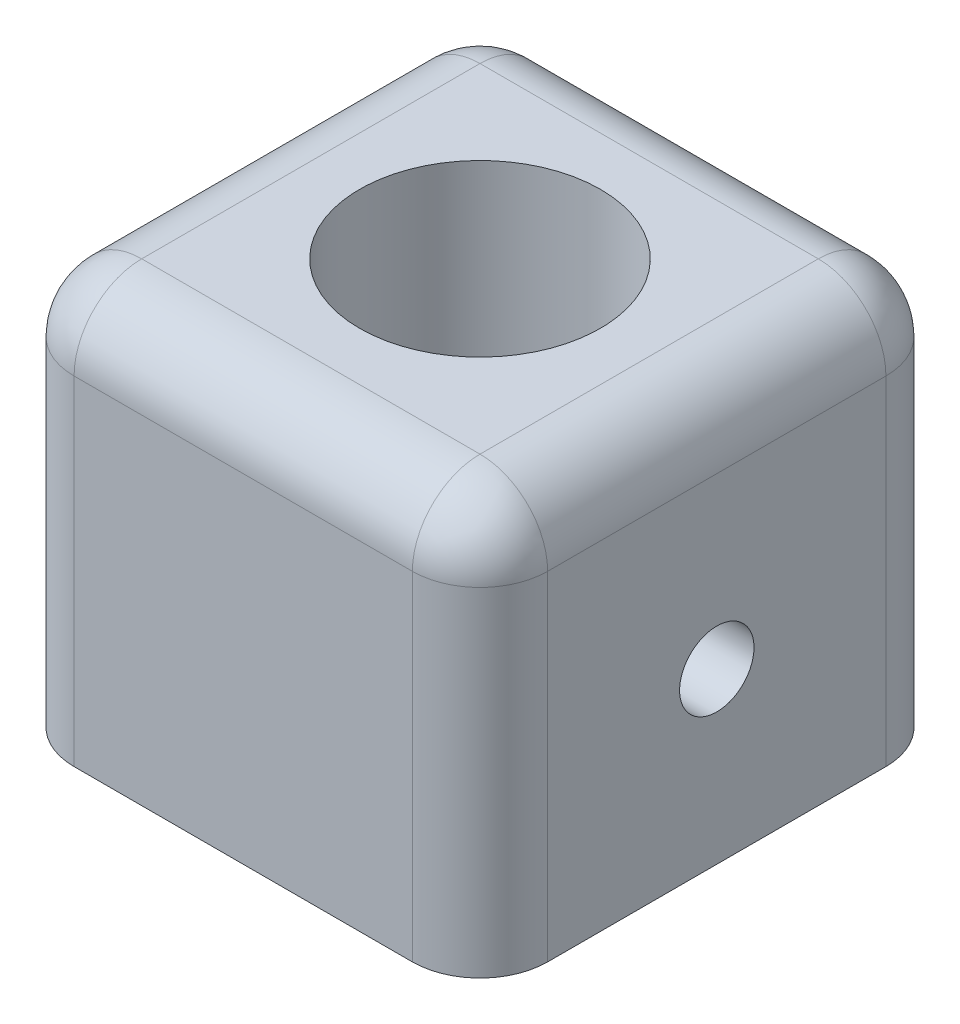
from build123d import *

# Parameters (mm, degrees)
SKETCH1_W                      = 35
SKETCH1_H                      = 35
BOSS_EXTRUDE1_DEPTH            = 30
SKETCH2_W                      = 20
SKETCH2_H                      = 20
CUT_EXTRUDE1_DEPTH             = 15
SKETCH3_R                      = 8.9
CUT_EXTRUDE2_DEPTH             = 58.879184514
CBORE_FOR_M2_SHCS1_D           = 2.6
CBORE_FOR_M2_SHCS1_DEPTH       = 7.5
CBORE_FOR_M2_SHCS1_CBORE_D     = 5.5
CBORE_FOR_M2_SHCS1_CBORE_DEPTH = 6
CBORE_FOR_M2_SHCS2_D           = 2.6
CBORE_FOR_M2_SHCS2_CBORE_D     = 5.5
CBORE_FOR_M2_SHCS2_CBORE_DEPTH = 6
FILLET1_R                      = 5
FILLET2_R                      = 5
M3X0_5_TAPPED_HOLE1_D          = 2.5
M3X0_5_TAPPED_HOLE1_DEPTH      = 5
M3X0_5_TAPPED_HOLE1_TIP        = 0.751075774


with BuildPart() as part:
    # Sketch1 → Boss-Extrude1 (new body)
    with BuildSketch(Plane(origin=(0, 0, 0), x_dir=(1, 0, 0), z_dir=(0, 1, 0))):
        with Locations((17.5, 17.5)):
            Rectangle(SKETCH1_W, SKETCH1_H)
    extrude(amount=BOSS_EXTRUDE1_DEPTH)

    # Sketch2 → Cut-Extrude1 (cut)
    with BuildSketch(Plane.XZ):
        with Locations((17.5, -17.5)):
            Rectangle(SKETCH2_W, SKETCH2_H)
    extrude(amount=-CUT_EXTRUDE1_DEPTH, mode=Mode.SUBTRACT)

    # Sketch3 → Cut-Extrude2 (cut, through all)
    with BuildSketch(Plane(origin=(0, 30, 0), x_dir=(1, 0, 0), z_dir=(0, 1, 0))):
        with Locations(Location((17.5, 17.5, 0), (0, 0, 270))):
            Circle(SKETCH3_R)
    extrude(amount=-CUT_EXTRUDE2_DEPTH, mode=Mode.SUBTRACT)

    # CBORE for M2 SHCS1
    with Locations(Plane(origin=(35, 12.5, -17.5), x_dir=(0, 0, 1), z_dir=(1, 0, 0))):
        with Locations((0, 0)):
            CounterBoreHole(CBORE_FOR_M2_SHCS1_D / 2, CBORE_FOR_M2_SHCS1_CBORE_D / 2, CBORE_FOR_M2_SHCS1_CBORE_DEPTH, depth=CBORE_FOR_M2_SHCS1_DEPTH)

    # CBORE for M2 SHCS2 (through all)
    with Locations(Plane(origin=(0, 12.5, -17.5), x_dir=(0, 0, -1), z_dir=(-1, 0, 0))):
        with Locations((0, 0)):
            CounterBoreHole(CBORE_FOR_M2_SHCS2_D / 2, CBORE_FOR_M2_SHCS2_CBORE_D / 2, CBORE_FOR_M2_SHCS2_CBORE_DEPTH)

    # Fillet1
    fillet1_edges = [part.edges().sort_by_distance(p)[0] for p in [
        (35, 30, -17.5),
        (17.5, 30, -35),
        (0, 30, -17.5),
        (17.5, 30, 0),
    ]]
    fillet(fillet1_edges, radius=FILLET1_R)

    # Fillet2
    # the kernel refuses this fillet: 5 mm, written as the material it takes off along each edge
    with BuildSketch(Plane(origin=(30, 25, -30), x_dir=(0, 0, -1), z_dir=(1, 0, 0))) as fillet2_piece_1_section:
        Polygon((0, 0), (FILLET2_R, 0), (FILLET2_R, FILLET2_R), (0, FILLET2_R), align=None)
    fillet2_piece_1 = extrude(amount=FILLET2_R, mode=Mode.PRIVATE)
    fillet2_piece_1 = fillet2_piece_1 - Plane(origin=(30, 25, -30), x_dir=(0, -0.7071067811865475, 0.7071067811865475), z_dir=(1, 0, 0)) * Sphere(FILLET2_R, mode=Mode.PRIVATE)
    add(fillet2_piece_1, mode=Mode.SUBTRACT)
    with BuildSketch(Plane(origin=(30, 25, -5), x_dir=(1, 0, 0), z_dir=(0, 0, 1))) as fillet2_piece_2_section:
        Polygon((0, 0), (FILLET2_R, 0), (FILLET2_R, FILLET2_R), (0, FILLET2_R), align=None)
    fillet2_piece_2 = extrude(amount=FILLET2_R, mode=Mode.PRIVATE)
    fillet2_piece_2 = fillet2_piece_2 - Plane(origin=(30, 25, -5), x_dir=(-0.7071067811865475, -0.7071067811865475, 0), z_dir=(0, 0, 1)) * Sphere(FILLET2_R, mode=Mode.PRIVATE)
    add(fillet2_piece_2, mode=Mode.SUBTRACT)
    with BuildSketch(Plane(origin=(5, 25, -30), x_dir=(0, 0, -1), z_dir=(-1, 0, 0))) as fillet2_piece_3_section:
        Polygon((0, 0), (FILLET2_R, 0), (FILLET2_R, -FILLET2_R), (0, -FILLET2_R), align=None)
    fillet2_piece_3 = extrude(amount=FILLET2_R, mode=Mode.PRIVATE)
    fillet2_piece_3 = fillet2_piece_3 - Plane(origin=(5, 25, -30), x_dir=(0, -0.7071067811865475, 0.7071067811865475), z_dir=(-1, 0, 0)) * Sphere(FILLET2_R, mode=Mode.PRIVATE)
    add(fillet2_piece_3, mode=Mode.SUBTRACT)
    with BuildSketch(Plane(origin=(5, 25, -5), x_dir=(-1, 0, 0), z_dir=(0, 0, 1))) as fillet2_piece_4_section:
        Polygon((0, 0), (FILLET2_R, 0), (FILLET2_R, -FILLET2_R), (0, -FILLET2_R), align=None)
    fillet2_piece_4 = extrude(amount=FILLET2_R, mode=Mode.PRIVATE)
    fillet2_piece_4 = fillet2_piece_4 - Plane(origin=(5, 25, -5), x_dir=(0.7071067811865475, -0.7071067811865475, 0), z_dir=(0, 0, 1)) * Sphere(FILLET2_R, mode=Mode.PRIVATE)
    add(fillet2_piece_4, mode=Mode.SUBTRACT)
    with BuildSketch(Plane(origin=(0, -12.5, 0), x_dir=(1, 0, 0), z_dir=(0, 1, 0)), Plane(origin=(0, -12.5, -35), x_dir=(0, 0, 1), z_dir=(0, 1, 0))) as fillet2_piece_5:
        with BuildLine():
            CenterArc((FILLET2_R, FILLET2_R), FILLET2_R, 180, 90)
            Line((0, FILLET2_R), (0, 0))
            Line((0, 0), (FILLET2_R, 0))
        make_face()
    extrude(amount=37.5, mode=Mode.SUBTRACT)
    with BuildSketch(Plane(origin=(35, -12.5, -35), x_dir=(0, 0, 1), z_dir=(0, 1, 0)), Plane(origin=(35, -12.5, 0), x_dir=(-1, 0, 0), z_dir=(0, 1, 0))) as fillet2_piece_6:
        with BuildLine():
            CenterArc((FILLET2_R, -FILLET2_R), FILLET2_R, 90, 90)
            Line((0, -FILLET2_R), (0, 0))
            Line((0, 0), (FILLET2_R, 0))
        make_face()
    extrude(amount=37.5, mode=Mode.SUBTRACT)

    # M3x0.5 Tapped Hole1
    with Locations(Plane(origin=(17.5, 0, -31.25), x_dir=(0, 0, -1), z_dir=(0, -1, 0))):
        with Locations((0, 0), (-13.75, -13.75), (-27.5, 0), (-13.75, 13.75)):
            Hole(M3X0_5_TAPPED_HOLE1_D / 2, depth=M3X0_5_TAPPED_HOLE1_DEPTH)
            with Locations((0, 0, -(M3X0_5_TAPPED_HOLE1_DEPTH + M3X0_5_TAPPED_HOLE1_TIP / 2))):  # 118° drill point
                Cone(0, M3X0_5_TAPPED_HOLE1_D / 2, M3X0_5_TAPPED_HOLE1_TIP, mode=Mode.SUBTRACT)


solid = part.part
